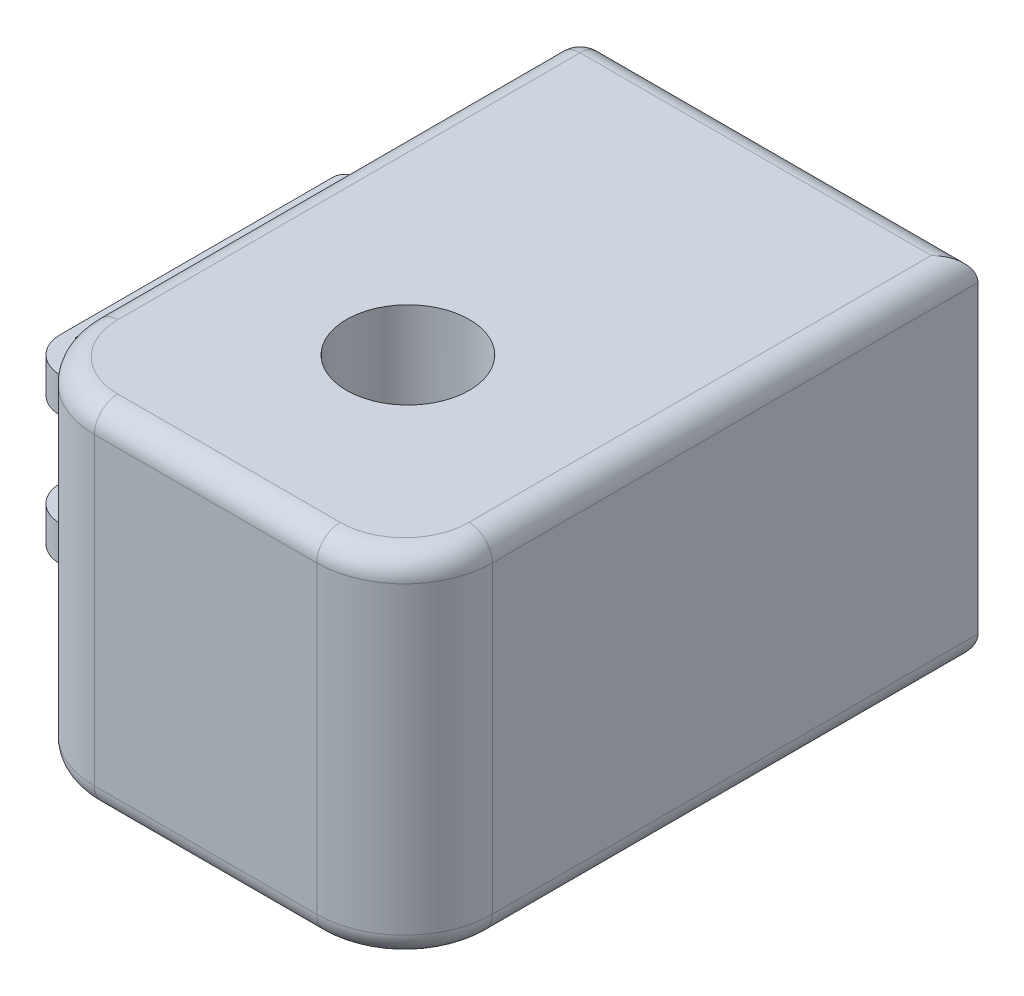
from build123d import *

# Parameters (mm, degrees)
SKETCH1_W           = 34
SKETCH1_H           = 30
BOSS_EXTRUDE1_DEPTH = 49
SKETCH2_R           = 2.1
CUT_EXTRUDE1_DEPTH  = 6
SKETCH5_R           = 11.15
CUT_EXTRUDE2_DEPTH  = 12.5
SKETCH6_R           = 5.25
CUT_EXTRUDE3_DEPTH  = 17.5
SKETCH7_R           = 2.1
CUT_EXTRUDE4_DEPTH  = 6
CHAMFER1_SIZE       = 1
CHAMFER2_SIZE       = 1
FILLET1_R           = 7.5
FILLET2_R           = 2
BOSS_EXTRUDE2_START = 4
SKETCH9_W           = 7.353949633
SKETCH9_H           = 27.286831646
SKETCH9_R           = 1.625
BOSS_EXTRUDE2_DEPTH = 3
FILLET3_R           = 3
FILLET4_R           = 1
CUT_EXTRUDE6_DEPTH  = 2


with BuildPart() as part:
    # Sketch1 → Boss-Extrude1 (new body)
    with BuildSketch(Plane.XY):
        Rectangle(SKETCH1_W, SKETCH1_H)
    extrude(amount=BOSS_EXTRUDE1_DEPTH)

    # Sketch2 → Cut-Extrude1 (cut)
    with BuildSketch(Plane(origin=(0, 0, 0), x_dir=(-1, 0, 0), z_dir=(0, 0, -1))):
        with Locations((12, -9)):
            Circle(SKETCH2_R)
        with Locations((12, 9)):
            Circle(SKETCH2_R)
        with Locations((-12, -9)):
            Circle(SKETCH2_R)
        with Locations((-12, 9)):
            Circle(SKETCH2_R)
    extrude(amount=-CUT_EXTRUDE1_DEPTH, mode=Mode.SUBTRACT)

    # Sketch5 → Cut-Extrude2 (cut)
    with BuildSketch(Plane.XZ.offset(15)):
        with Locations(Location((0, 31.713602896, 0), (0, 0, 270))):
            Circle(SKETCH5_R)
    extrude(amount=-CUT_EXTRUDE2_DEPTH, mode=Mode.SUBTRACT)

    # Sketch6 → Cut-Extrude3 (cut)
    with BuildSketch(Plane(origin=(0, 15, 0), x_dir=(1, 0, 0), z_dir=(0, 1, 0))):
        with Locations(Location((0, -31.713602896, 0), (0, 0, 270))):
            Circle(SKETCH6_R)
    extrude(amount=-CUT_EXTRUDE3_DEPTH, mode=Mode.SUBTRACT)

    # Sketch7 → Cut-Extrude4 (cut)
    with BuildSketch(Plane.XZ.offset(2.5)):
        with Locations(Location((-7.978464084, 31.126993267, 0), (0, 0, 270))):
            Circle(SKETCH7_R)
        with Locations(Location((-0.586609629, 39.692066981, 0), (0, 0, 270))):
            Circle(SKETCH7_R)
        with Locations(Location((7.978464084, 31.126993267, 0), (0, 0, 270))):
            Circle(SKETCH7_R)
        with Locations(Location((0.586609629, 23.735138812, 0), (0, 0, 270))):
            Circle(SKETCH7_R)
    extrude(amount=-CUT_EXTRUDE4_DEPTH, mode=Mode.SUBTRACT)

    # Chamfer1
    # the kernel refuses this chamfer: 1 mm, written as the material it takes off along each edge
    with BuildSketch(Plane(origin=(-7.978464084, -2.5, 31.126993267), x_dir=(0, 0, -1), z_dir=(-1, 0, 0))) as chamfer1_piece_1:
        Polygon((2.1 + CHAMFER1_SIZE, 0), (2.1, -CHAMFER1_SIZE), (2.1, 0), align=None)
    revolve(axis=Axis((-7.978464084, -2.5, 31.126993267), (0, -1, 0)), mode=Mode.SUBTRACT)
    with BuildSketch(Plane(origin=(-0.586609629, -2.5, 39.692066981), x_dir=(0, 0, -1), z_dir=(-1, 0, 0))) as chamfer1_piece_2:
        Polygon((2.1 + CHAMFER1_SIZE, 0), (2.1, -CHAMFER1_SIZE), (2.1, 0), align=None)
    revolve(axis=Axis((-0.586609629, -2.5, 39.692066981), (0, -1, 0)), mode=Mode.SUBTRACT)
    with BuildSketch(Plane(origin=(7.978464084, -2.5, 31.126993267), x_dir=(0, 0, -1), z_dir=(-1, 0, 0))) as chamfer1_piece_3:
        Polygon((2.1 + CHAMFER1_SIZE, 0), (2.1, -CHAMFER1_SIZE), (2.1, 0), align=None)
    revolve(axis=Axis((7.978464084, -2.5, 31.126993267), (0, -1, 0)), mode=Mode.SUBTRACT)
    with BuildSketch(Plane(origin=(0.586609629, -2.5, 23.735138812), x_dir=(0, 0, -1), z_dir=(-1, 0, 0))) as chamfer1_piece_4:
        Polygon((2.1 + CHAMFER1_SIZE, 0), (2.1, -CHAMFER1_SIZE), (2.1, 0), align=None)
    revolve(axis=Axis((0.586609629, -2.5, 23.735138812), (0, -1, 0)), mode=Mode.SUBTRACT)

    # Chamfer2
    chamfer2_edges = [part.edges().sort_by_distance(p)[0] for p in [
        (-9.9, 9, 0),
        (14.1, -9, 0),
        (14.1, 9, 0),
        (-9.9, -9, 0),
    ]]
    chamfer(chamfer2_edges, length=CHAMFER2_SIZE)

    # Fillet1
    fillet1_edges = [part.edges().sort_by_distance(p)[0] for p in [
        (-17, 0, 49),
        (17, 0, 49),
    ]]
    fillet(fillet1_edges, radius=FILLET1_R)

    # Fillet2
    # the kernel refuses this fillet: 2 mm, written as the material it takes off along each edge
    with BuildSketch(Plane(origin=(-15, -13, 2), x_dir=(0, 0, -1), z_dir=(0, -1, 0))) as fillet2_piece_1_section:
        Polygon((0, 0), (FILLET2_R, 0), (FILLET2_R, -FILLET2_R), (0, -FILLET2_R), align=None)
    fillet2_piece_1 = extrude(amount=FILLET2_R, mode=Mode.PRIVATE)
    fillet2_piece_1 = fillet2_piece_1 - Plane(origin=(-15, -13, 2), x_dir=(0.7071067811865475, 0, 0.7071067811865475), z_dir=(0, -1, 0)) * Sphere(FILLET2_R, mode=Mode.PRIVATE)
    add(fillet2_piece_1, mode=Mode.SUBTRACT)
    with BuildSketch(Plane(origin=(-15, 13, 2), x_dir=(0, 0, -1), z_dir=(0, 1, 0))) as fillet2_piece_2_section:
        Polygon((0, 0), (FILLET2_R, 0), (FILLET2_R, FILLET2_R), (0, FILLET2_R), align=None)
    fillet2_piece_2 = extrude(amount=FILLET2_R, mode=Mode.PRIVATE)
    fillet2_piece_2 = fillet2_piece_2 - Plane(origin=(-15, 13, 2), x_dir=(0.7071067811865475, 0, 0.7071067811865475), z_dir=(0, 1, 0)) * Sphere(FILLET2_R, mode=Mode.PRIVATE)
    add(fillet2_piece_2, mode=Mode.SUBTRACT)
    with BuildSketch(Plane(origin=(9.5, 15, 41.5), x_dir=(1, 0, 0), z_dir=(0, 0, -1))) as fillet2_piece_3:
        with BuildLine():
            CenterArc((7.5 - FILLET2_R, FILLET2_R), FILLET2_R, 270, 90)
            Line((7.5 - FILLET2_R, 0), (7.5, 0))
            Line((7.5, 0), (7.5, FILLET2_R))
        make_face()
    revolve(axis=Axis((9.5, 15, 41.5), (0, -1, 0)), revolution_arc=90, mode=Mode.SUBTRACT)
    with BuildSketch(Plane(origin=(17, -15, -5), x_dir=(-1, 0, 0), z_dir=(0, 0, 1)), Plane(origin=(17, 15, -5), x_dir=(0, -1, 0), z_dir=(0, 0, 1))) as fillet2_piece_4:
        with BuildLine():
            CenterArc((FILLET2_R, -FILLET2_R), FILLET2_R, 90, 90)
            Line((0, -FILLET2_R), (0, 0))
            Line((0, 0), (FILLET2_R, 0))
        make_face()
    extrude(amount=46.5, mode=Mode.SUBTRACT)
    with BuildSketch(Plane(origin=(-17, -15, 2), x_dir=(1, 0, 0), z_dir=(0, 0, 1)), Plane(origin=(-17, 15, 2), x_dir=(0, -1, 0), z_dir=(0, 0, 1))) as fillet2_piece_5:
        with BuildLine():
            CenterArc((FILLET2_R, FILLET2_R), FILLET2_R, 180, 90)
            Line((0, FILLET2_R), (0, 0))
            Line((0, 0), (FILLET2_R, 0))
        make_face()
    extrude(amount=39.5, mode=Mode.SUBTRACT)
    with BuildSketch(Plane(origin=(-9.5, -15, 41.5), x_dir=(-1, 0, 0), z_dir=(0, 0, -1))) as fillet2_piece_6:
        with BuildLine():
            CenterArc((7.5 - FILLET2_R, FILLET2_R), FILLET2_R, 270, 90)
            Line((7.5, FILLET2_R), (7.5, 0))
            Line((7.5, 0), (7.5 - FILLET2_R, 0))
        make_face()
    revolve(axis=Axis((-9.5, -15, 41.5), (0, 1, 0)), revolution_arc=90, mode=Mode.SUBTRACT)
    with BuildSketch(Plane(origin=(9.5, -15, 41.5), x_dir=(1, 0, 0), z_dir=(0, 0, -1))) as fillet2_piece_7:
        with BuildLine():
            CenterArc((7.5 - FILLET2_R, -FILLET2_R), FILLET2_R, 0, 90)
            Line((7.5, -FILLET2_R), (7.5, 0))
            Line((7.5, 0), (7.5 - FILLET2_R, 0))
        make_face()
    revolve(axis=Axis((9.5, -15, 41.5), (0, -1, 0)), revolution_arc=90, mode=Mode.SUBTRACT)
    with BuildSketch(Plane(origin=(22, -15, 0), x_dir=(0, 0, 1), z_dir=(-1, 0, 0))) as fillet2_piece_8:
        with BuildLine():
            CenterArc((FILLET2_R, FILLET2_R), FILLET2_R, 180, 90)
            Line((0, FILLET2_R), (0, 0))
            Line((0, 0), (FILLET2_R, 0))
        make_face()
    extrude(amount=37, mode=Mode.SUBTRACT)
    with BuildSketch(Plane(origin=(-17, -13, 0), x_dir=(1, 0, 0), z_dir=(0, 1, 0))) as fillet2_piece_9:
        with BuildLine():
            CenterArc((FILLET2_R, -FILLET2_R), FILLET2_R, 90, 90)
            Line((0, -FILLET2_R), (0, 0))
            Line((0, 0), (FILLET2_R, 0))
        make_face()
    extrude(amount=26, mode=Mode.SUBTRACT)
    with BuildSketch(Plane(origin=(-15, 15, 0), x_dir=(0, -1, 0), z_dir=(1, 0, 0))) as fillet2_piece_10:
        with BuildLine():
            CenterArc((FILLET2_R, -FILLET2_R), FILLET2_R, 90, 90)
            Line((0, -FILLET2_R), (0, 0))
            Line((0, 0), (FILLET2_R, 0))
        make_face()
    extrude(amount=37, mode=Mode.SUBTRACT)
    with BuildSketch(Plane(origin=(-9.5, 15, 49), x_dir=(0, -1, 0), z_dir=(1, 0, 0))) as fillet2_piece_11:
        with BuildLine():
            CenterArc((FILLET2_R, FILLET2_R), FILLET2_R, 180, 90)
            Line((0, FILLET2_R), (0, 0))
            Line((0, 0), (FILLET2_R, 0))
        make_face()
    extrude(amount=19, mode=Mode.SUBTRACT)
    with BuildSketch(Plane(origin=(9.5, -15, 49), x_dir=(0, 0, -1), z_dir=(-1, 0, 0))) as fillet2_piece_12:
        with BuildLine():
            CenterArc((FILLET2_R, -FILLET2_R), FILLET2_R, 90, 90)
            Line((0, -FILLET2_R), (0, 0))
            Line((0, 0), (FILLET2_R, 0))
        make_face()
    extrude(amount=19, mode=Mode.SUBTRACT)
    with BuildSketch(Plane(origin=(-9.5, 15, 41.5), x_dir=(-1, 0, 0), z_dir=(0, 0, -1))) as fillet2_piece_13:
        with BuildLine():
            CenterArc((7.5 - FILLET2_R, -FILLET2_R), FILLET2_R, 0, 90)
            Line((7.5 - FILLET2_R, 0), (7.5, 0))
            Line((7.5, 0), (7.5, -FILLET2_R))
        make_face()
    revolve(axis=Axis((-9.5, 15, 41.5), (0, 1, 0)), revolution_arc=90, mode=Mode.SUBTRACT)

    # Sketch9 → Boss-Extrude2 (add)
    with BuildSketch(Plane(origin=(0, 0, 0), x_dir=(1, 0, 0), z_dir=(0, 1, 0)).offset(BOSS_EXTRUDE2_START)):
        with Locations((-20.676974816, -26.405648135)):
            Rectangle(SKETCH9_W, SKETCH9_H)
        with Locations(Location((-20.6, -35, 0), (0, 0, 270))):
            Circle(SKETCH9_R, mode=Mode.SUBTRACT)
        with Locations(Location((-20.6, -19, 0), (0, 0, 270))):
            Circle(SKETCH9_R, mode=Mode.SUBTRACT)
    boss_extrude2 = extrude(amount=BOSS_EXTRUDE2_DEPTH)

    # Mirror1: Boss-Extrude2 across plane
    add(boss_extrude2.mirror(Plane.ZX))

    # Fillet3
    fillet3_edges = [part.edges().sort_by_distance(p)[0] for p in [
        (-24.353949633, 5.5, 40.049063958),
        (-24.353949633, -5.5, 40.049063958),
    ]]
    fillet(fillet3_edges, radius=FILLET3_R)

    # Fillet4
    fillet4_edges = [part.edges().sort_by_distance(p)[0] for p in [
        (-17, 5.5, 12.762232312),
        (-24.353949633, 5.5, 12.762232312),
        (-17, -5.5, 12.762232312),
        (-24.353949633, -5.5, 12.762232312),
    ]]
    fillet(fillet4_edges, radius=FILLET4_R)

    # Sketch10 → Cut-Extrude6 (cut)
    with BuildSketch(Plane(origin=(0, 7, 0), x_dir=(1, 0, 0), z_dir=(0, 1, 0))):
        Polygon((-17.725, -20.659882024), (-17.725, -17.340117976), (-20.6, -15.680235952), (-23.475, -17.340117976), (-23.475, -20.659882024), (-20.6, -22.319764048), align=None)
        Polygon((-17.725, -36.659882024), (-17.725, -33.340117976), (-20.6, -31.680235952), (-23.475, -33.340117976), (-23.475, -36.659882024), (-20.6, -38.319764048), align=None)
    extrude(amount=-CUT_EXTRUDE6_DEPTH, mode=Mode.SUBTRACT)


solid = part.part
